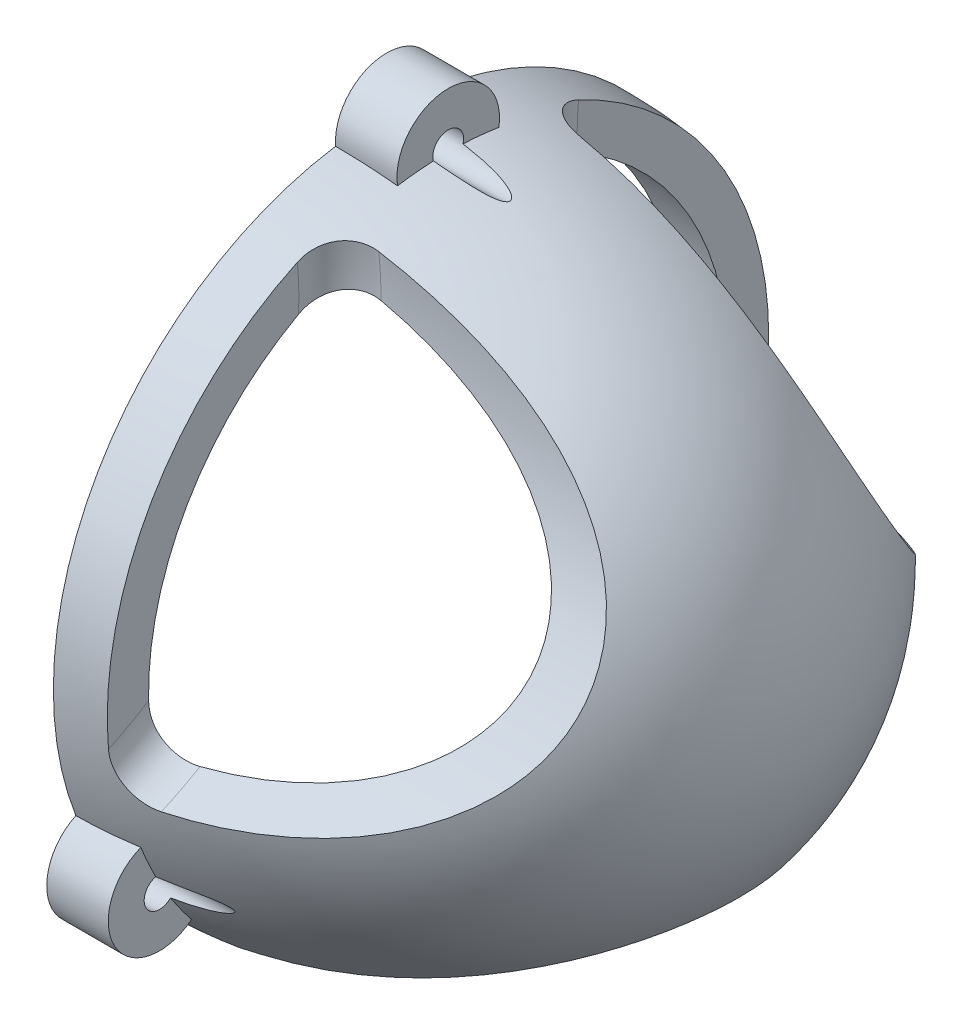
from build123d import *

# Parameters (mm, degrees)
VACIADO1_T              = -4
CORTAR_EXTRUIR1_DEPTH   = 58.771100215
SALIENTE_EXTRUIR2_DEPTH = 6
CROQUIS4_R              = 1.5
CORTAR_EXTRUIR2_DEPTH   = 15
REDONDEO1_R             = 4


with BuildPart() as part:
    # Croquis1 → Revolución1 (revolve)
    with BuildSketch(Plane.XY):
        with BuildLine():
            Line((0, 0), (0, -32.5))
            add(Edge.make_bspline(
                [(0, -32.5), (40, -32.5), (40, 0)],
                knots=[4.71238898, 4.71238898, 4.71238898, 6.283185307, 6.283185307, 6.283185307], degree=2, weights=[1, 0.707106781, 1]))
            Line((40, 0), (0, 0))
        make_face()
    revolve(axis=Axis((40, 0, 0), (-1, 0, 0)))

    # Vaciado1
    vaciado1_openings = [part.faces().sort_by_distance(p)[0] for p in [
        (0, 0, 0),
    ]]
    offset(amount=VACIADO1_T, openings=vaciado1_openings, kind=Kind.INTERSECTION)

    # Croquis2 → Cortar-Extruir1 (cut, through all)
    with BuildSketch(Plane(origin=(5, 0, 0), x_dir=(0, 0, -1), z_dir=(1, 0, 0))):
        with BuildLine():
            ThreePointArc((31.753952917, -6.92361713), (28.145825623, 16.25), (9.880948137, 30.961538462))
            ThreePointArc((9.880948137, 30.961538462), (14.359601917, 8.290520032), (31.753952917, -6.92361713))
        make_face()
        with BuildLine():
            ThreePointArc((-31.753952917, -6.92361713), (-14.359601917, 8.290520032), (-9.880948137, 30.961538462))
            ThreePointArc((-9.880948137, 30.961538462), (-28.145825623, 16.25), (-31.753952917, -6.92361713))
        make_face()
        with BuildLine():
            ThreePointArc((21.873004779, -24.037921331), (0, -16.581040064), (-21.873004779, -24.037921331))
            ThreePointArc((-21.873004779, -24.037921331), (0, -32.5), (21.873004779, -24.037921331))
        make_face()
    extrude(amount=CORTAR_EXTRUIR1_DEPTH, mode=Mode.SUBTRACT)

    # Croquis3 → Saliente-Extruir2 (add)
    with BuildSketch(Plane(origin=(0, 0, 0), x_dir=(0, 0, -1), z_dir=(1, 0, 0))):
        with BuildLine():
            ThreePointArc((3.675587515, 29.110301426), (0, 37.5), (-3.675587515, 29.110301426))
            Line((-3.675587515, 29.110301426), (3.675587515, 29.110301426))
        make_face()
        with BuildLine():
            Line((27.260116074, -11.329073401), (23.647821666, -18.433565984))
            ThreePointArc((23.647821666, -18.433565984), (32.602791687, -18.516153902), (27.260116074, -11.329073401))
        make_face()
        with BuildLine():
            ThreePointArc((-28.145825623, -11.25), (-32.383621626, -18.903504295), (-23.647821666, -18.433565984))
            Line((-23.647821666, -18.433565984), (-28.145825623, -11.25))
        make_face()
    extrude(amount=SALIENTE_EXTRUIR2_DEPTH)

    # Croquis4 → Cortar-Extruir2 (cut)
    with BuildSketch(Plane.ZY):
        with Locations((0, 32.5)):
            Circle(CROQUIS4_R)
        with Locations((28.145825623, -16.25)):
            Circle(CROQUIS4_R)
        with Locations((-28.145825623, -16.25)):
            Circle(CROQUIS4_R)
    extrude(amount=-CORTAR_EXTRUIR2_DEPTH, mode=Mode.SUBTRACT)

    # Redondeo1
    redondeo1_edges = [part.edges().sort_by_distance(p)[0] for p in [
        (5, -22.669408308, -19.973920533),
        (5, -22.669408308, 19.973920533),
        (5, -5.963218441, -29.61924375),
        (5, 28.63262675, -9.645323217),
        (5, -5.963218441, 29.61924375),
        (5, 28.63262675, 9.645323217),
    ]]
    fillet(redondeo1_edges, radius=REDONDEO1_R)


solid = part.part
